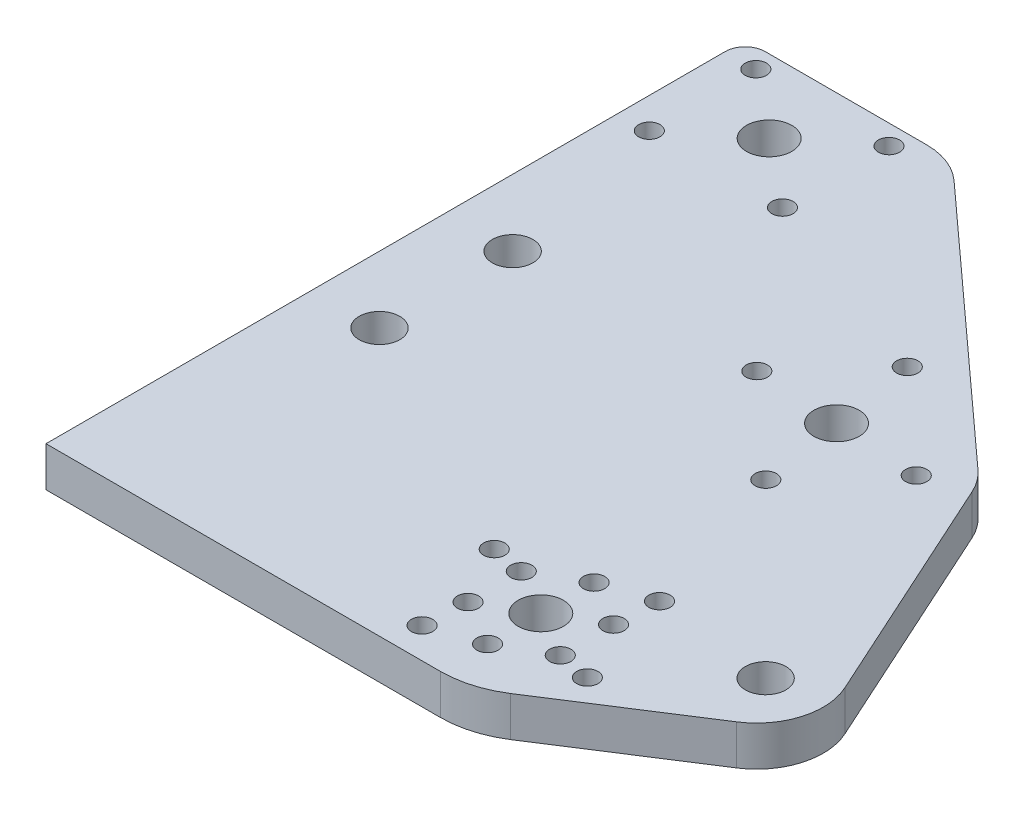
from build123d import *

# Parameters (mm, degrees)
ESBO_O1_R                = 1.6
ESBO_O1_R_2              = 3.05
ESBO_O1_R_3              = 3.4
RESSALTO_EXTRUS_O1_DEPTH = 6
ESBO_O2_R                = 3.05
CORTE_EXTRUS_O1_DEPTH    = 10


with BuildPart() as part:
    # Esboço1 → Ressalto-extrusão1 (new body)
    with BuildSketch(Plane.XZ.offset(6)):
        with BuildLine():
            Line((151.235707119, -14.290882553), (167.194797105, 20.786465148))
            ThreePointArc((167.194797105, 20.786465148), (167.685761217, 27.75097204), (163.500492356, 33.339256802))
            Line((163.500492356, 33.339256802), (142.828800476, 46.629357452))
            ThreePointArc((142.828800476, 46.629357452), (138.919886426, 48.415130742), (134.666145804, 49.026919929))
            Line((134.666145804, 49.026919929), (75.43742995, 49.026919929))
            Line((75.43742995, 49.026919929), (75.43742995, -53))
            ThreePointArc((75.43742995, -53), (76.316109606, -55.121320344), (78.43742995, -56))
            Line((78.43742995, -56), (102.684651367, -56))
            ThreePointArc((102.684651367, -56), (106.289825387, -55.327524875), (109.410121436, -53.400544058))
            Line((109.410121436, -53.400544058), (148.858963728, -17.550205761))
            ThreePointArc((148.858963728, -17.550205761), (150.213387743, -16.041631797), (151.235707119, -14.290882553))
        make_face()
        with Locations((119.376459837, -13.805034822)):
            Circle(ESBO_O1_R, mode=Mode.SUBTRACT)
        with Locations((146.515369287, 38.790560368)):
            Circle(ESBO_O1_R, mode=Mode.SUBTRACT)
        with Locations((142.006279165, 23.439074893)):
            Circle(ESBO_O1_R, mode=Mode.SUBTRACT)
        with Locations((159.995303964, 25.487660186)):
            Circle(ESBO_O1_R_2, mode=Mode.SUBTRACT)
        with Locations((100.03742995, -37)):
            Circle(ESBO_O1_R, mode=Mode.SUBTRACT)
        with Locations((100.03742995, -53)):
            Circle(ESBO_O1_R, mode=Mode.SUBTRACT)
        with Locations((80.03742995, -37)):
            Circle(ESBO_O1_R, mode=Mode.SUBTRACT)
        with Locations((80.03742995, -53)):
            Circle(ESBO_O1_R, mode=Mode.SUBTRACT)
        with Locations((122.816922322, 29.075437545)):
            Circle(ESBO_O1_R, mode=Mode.SUBTRACT)
        with Locations((127.326012444, 44.426923019)):
            Circle(ESBO_O1_R, mode=Mode.SUBTRACT)
        with Locations((130.137211947, -25.645905315)):
            Circle(ESBO_O1_R, mode=Mode.SUBTRACT)
        with Locations((144.938300063, -12.194965178)):
            Circle(ESBO_O1_R, mode=Mode.SUBTRACT)
        with Locations((134.177547953, -0.354094685)):
            Circle(ESBO_O1_R, mode=Mode.SUBTRACT)
        with Locations((141.594349035, 29.932998956)):
            Circle(ESBO_O1_R, mode=Mode.SUBTRACT)
        with Locations((134.666145804, 25.932998956)):
            Circle(ESBO_O1_R, mode=Mode.SUBTRACT)
        with Locations((127.737942574, 29.932998956)):
            Circle(ESBO_O1_R, mode=Mode.SUBTRACT)
        with Locations((127.737942574, 37.932998956)):
            Circle(ESBO_O1_R, mode=Mode.SUBTRACT)
        with Locations((134.666145804, 41.932998956)):
            Circle(ESBO_O1_R, mode=Mode.SUBTRACT)
        with Locations((141.594349035, 37.932998956)):
            Circle(ESBO_O1_R, mode=Mode.SUBTRACT)
        with Locations((134.666145804, 33.932998956)):
            Circle(ESBO_O1_R_3, mode=Mode.SUBTRACT)
        with Locations((132.15737995, -13)):
            Circle(ESBO_O1_R_3, mode=Mode.SUBTRACT)
        with Locations((90.03742995, -45)):
            Circle(ESBO_O1_R_3, mode=Mode.SUBTRACT)
    extrude(amount=-RESSALTO_EXTRUS_O1_DEPTH)

    # Esboço2 → Corte-extrusão1 (cut)
    with BuildSketch(Plane.XZ.offset(6)):
        with Locations((85.43742995, 8.932998956)):
            Circle(ESBO_O2_R)
        with Locations((85.43742995, -11.067001044)):
            Circle(ESBO_O2_R)
    extrude(amount=-CORTE_EXTRUS_O1_DEPTH, mode=Mode.SUBTRACT)


solid = part.part
